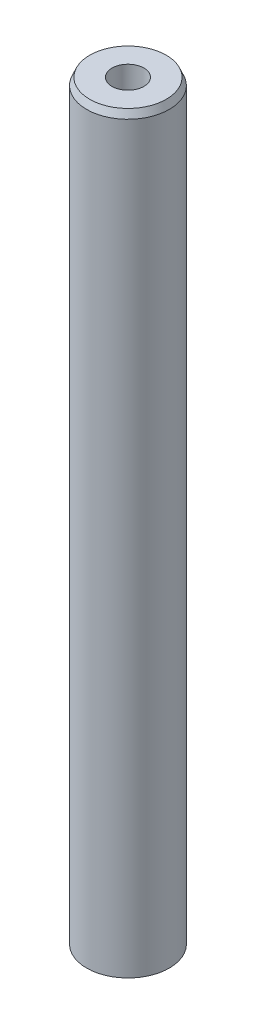
from build123d import *
from OCP.BRepFilletAPI import BRepFilletAPI_MakeChamfer

# Parameters (mm, degrees)
SKETCH1_R           = 7.5
BOSS_EXTRUDE1_DEPTH = 136.810048384
SKETCH2_R           = 2.895403939
CUT_EXTRUDE1_DEPTH  = 138.220586425
CHAMFER1_SIZE       = 1.309381867
CHAMFER1_SIZE2      = 0.558501712


with BuildPart() as part:
    # Sketch1 → Boss-Extrude1 (new body)
    with BuildSketch(Plane(origin=(0, 0, 0), x_dir=(1, 0, 0), z_dir=(0, 1, 0))):
        Circle(SKETCH1_R)
    extrude(amount=BOSS_EXTRUDE1_DEPTH)

    # Sketch2 → Cut-Extrude1 (cut, through all)
    with BuildSketch(Plane(origin=(0, 0, 0), x_dir=(1, 0, 0), z_dir=(0, 1, 0))):
        Circle(SKETCH2_R)
    extrude(amount=CUT_EXTRUDE1_DEPTH, mode=Mode.SUBTRACT)

    # Chamfer1: one chamfer whose edges measure the first distance from different faces: ONE call of the kernel's chamfer builder (chamfer() names one face for all edges)
    chamfer1_edges_1 = [part.edges().sort_by_distance(p)[0] for p in [
        (-7.5, 136.810048384, 0),
    ]]
    chamfer1_side_1 = [part.faces().sort_by_distance(p)[0] for p in [
        (-7.5, 68.405024192, 0),
    ]]
    chamfer1_edges_2 = [part.edges().sort_by_distance(p)[0] for p in [
        (-7.5, 0, 0),
    ]]
    chamfer1_side_2 = [part.faces().sort_by_distance(p)[0] for p in [
        (-7.287867966, 0, 0),
    ]]
    chamfer1 = BRepFilletAPI_MakeChamfer(part.part.solid().wrapped)
    for e in chamfer1_edges_1:
        chamfer1.Add(CHAMFER1_SIZE, CHAMFER1_SIZE2, e.wrapped, chamfer1_side_1[0].wrapped)  # the first distance lies on this face
    for e in chamfer1_edges_2:
        chamfer1.Add(CHAMFER1_SIZE, CHAMFER1_SIZE2, e.wrapped, chamfer1_side_2[0].wrapped)  # the first distance lies on this face
    add(Compound.cast(chamfer1.Shape()), mode=Mode.REPLACE)


solid = part.part
